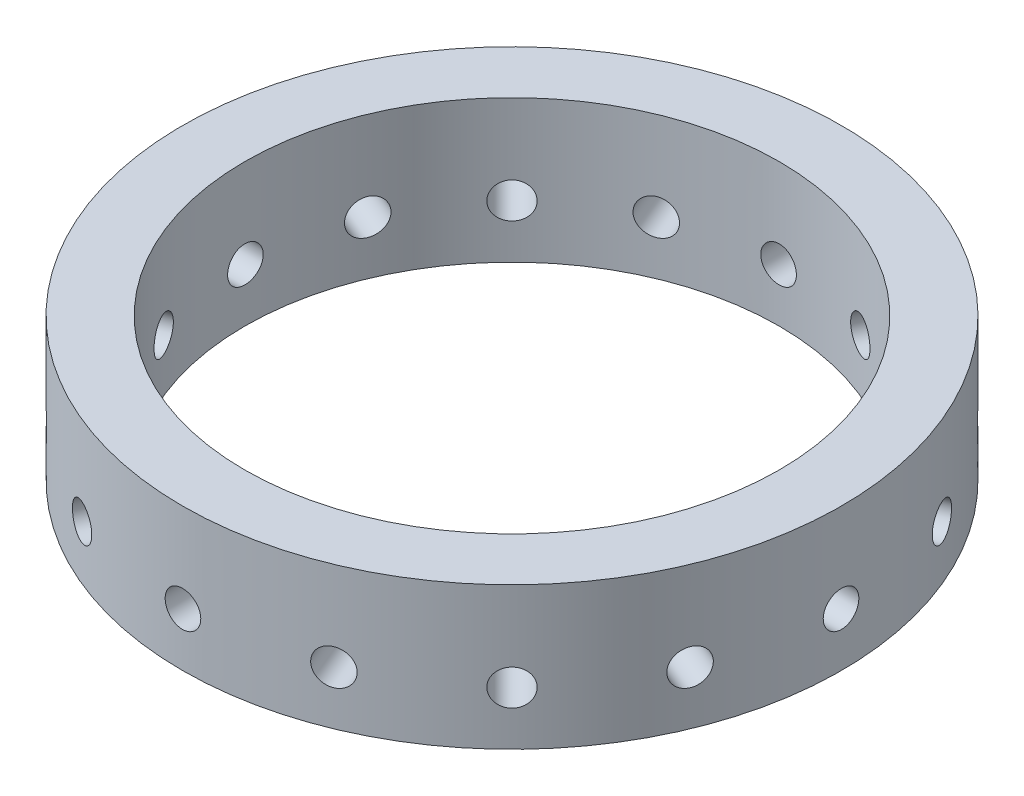
from build123d import *

# Parameters (mm, degrees)
SKETCH1_R                   = 58.7375
SKETCH1_R_2                 = 47.625
BOSS_EXTRUDE1_DEPTH         = 25.4
F_1_4_0_25_DIAMETER_HOLE1_D = 6.35
CIRPATTERN1_COUNT           = 16


with BuildPart() as part:
    # Sketch1 → Boss-Extrude1 (new body)
    with BuildSketch(Plane(origin=(0, 0, 0), x_dir=(1, 0, 0), z_dir=(0, 1, 0))):
        Circle(SKETCH1_R)
        Circle(SKETCH1_R_2, mode=Mode.SUBTRACT)
    extrude(amount=BOSS_EXTRUDE1_DEPTH)

    # 1/4 (0.25) Diameter Hole1 (through all)
    with Locations(Plane(origin=(0, 0, -58.7375), x_dir=(-1, 0, 0), z_dir=(0, 0, -1))):
        with Locations((0, 9.525)):
            f_1_4_0_25_diameter_hole1 = Hole(F_1_4_0_25_DIAMETER_HOLE1_D / 2)

    # CirPattern1: 1/4 (0.25) Diameter Hole1 ×16 about axis
    cirpattern1_axis = Axis((0, 0, 0), (0, 1, 0))
    for i in range(1, CIRPATTERN1_COUNT):
        add(f_1_4_0_25_diameter_hole1.rotate(cirpattern1_axis, i * 360 / CIRPATTERN1_COUNT), mode=Mode.SUBTRACT)


solid = part.part
